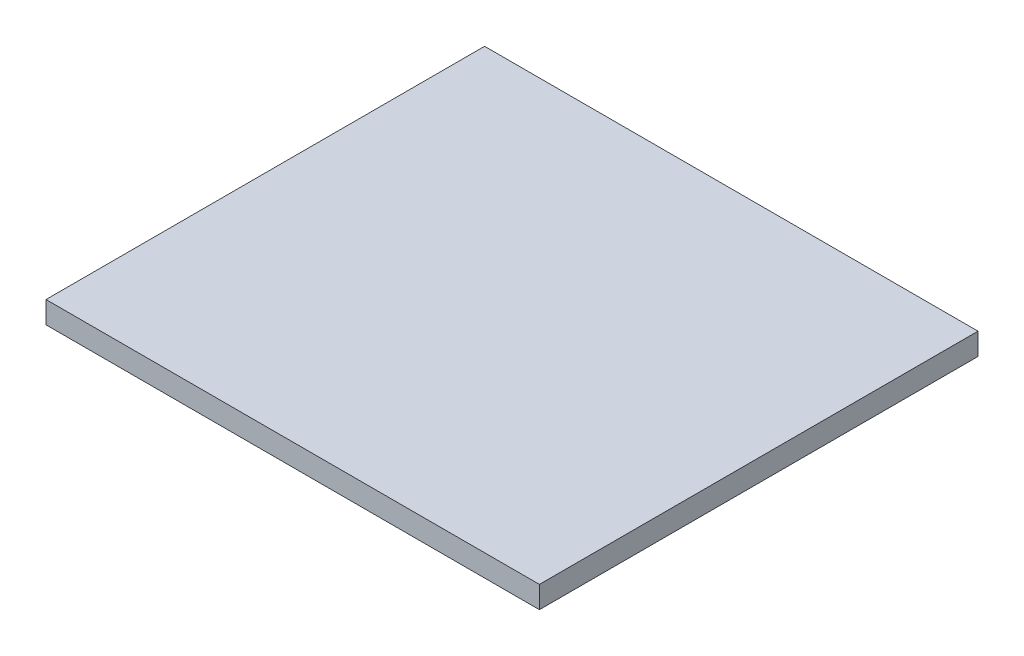
from build123d import *

# Parameters (mm, degrees)
CROQUIS1_W              = 90
CROQUIS1_H              = 80
SALIENTE_EXTRUIR1_DEPTH = 4


with BuildPart() as part:
    # Croquis1 → Saliente-Extruir1 (new body)
    with BuildSketch(Plane(origin=(0, 0, 0), x_dir=(1, 0, 0), z_dir=(0, 1, 0))):
        with Locations((45, -40)):
            Rectangle(CROQUIS1_W, CROQUIS1_H)
    extrude(amount=SALIENTE_EXTRUIR1_DEPTH)


solid = part.part
